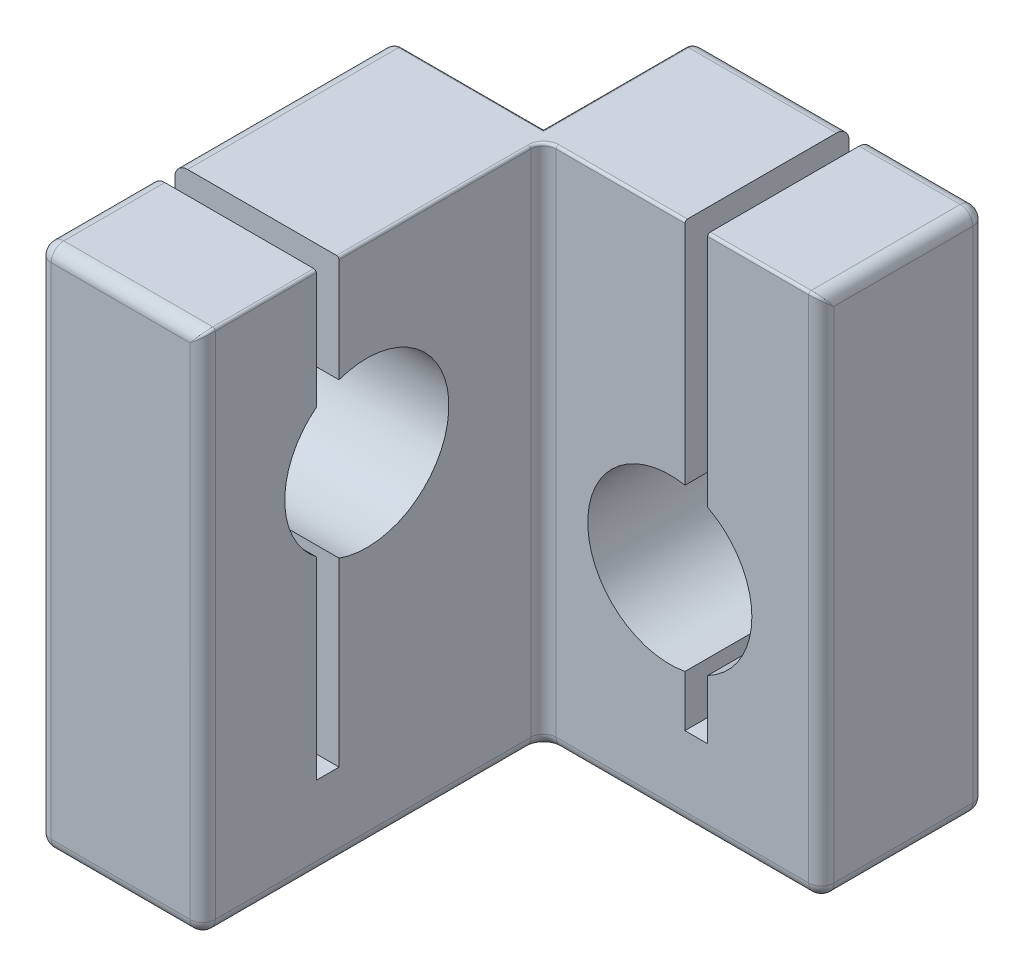
from build123d import *

# Parameters (mm, degrees)
BOSS_EXTRUDE1_DEPTH = 41.55
SKETCH2_W           = 12.292893219
SKETCH2_H           = 12.292893219
CUT_EXTRUDE1_DEPTH  = 13.25
FILLET1_R           = 4
FILLET2_R           = 1
FILLET3_R           = 0.2
SKETCH3_W           = 13
SKETCH3_H           = 1.8
SKETCH3_W_2         = 1.8
SKETCH3_H_2         = 13
CUT_EXTRUDE2_DEPTH  = 35
SKETCH4_R           = 6.5
CUT_EXTRUDE3_DEPTH  = 35
SKETCH5_R           = 6.5
CUT_EXTRUDE4_DEPTH  = 35
SKETCH6_R           = 2
CUT_EXTRUDE5_DEPTH  = 10.3


with BuildPart() as part:
    # Sketch1 → Boss-Extrude1 (new body)
    with BuildSketch(Plane(origin=(0, 0, 0), x_dir=(1, 0, 0), z_dir=(0, 1, 0))):
        Polygon((0, 0), (0, -40), (13, -40), (13, -13), (35, -13), (35, 0), align=None)
    extrude(amount=BOSS_EXTRUDE1_DEPTH)

    # Sketch2 → Cut-Extrude1 (cut)
    with BuildSketch(Plane(origin=(0, 41.55, 0), x_dir=(1, 0, 0), z_dir=(0, 1, 0))):
        with Locations((6.14644661, -6.14644661)):
            Rectangle(SKETCH2_W, SKETCH2_H)
    extrude(amount=-CUT_EXTRUDE1_DEPTH, mode=Mode.SUBTRACT)

    # Fillet1
    fillet1_edges = [part.edges().sort_by_distance(p)[0] for p in [
        (12.292893219, 28.3, 6.146446609),
    ]]
    fillet(fillet1_edges, radius=FILLET1_R)

    # Fillet2
    fillet2_edges = [part.edges().sort_by_distance(p)[0] for p in [
        (23.646446609, 41.55, 0),
        (12.292893219, 36.925, 0),
        (11.121320344, 29.471572875, 0),
        (4.146446609, 28.3, 0),
        (0, 14.15, 0),
        (0, 28.3, 6.146446609),
        (0, 34.925, 12.292893219),
        (0, 41.55, 26.146446609),
        (0, 0, 20),
        (17.5, 0, 0),
        (35, 41.55, 6.5),
        (35, 20.775, 0),
        (35, 0, 6.5),
        (13, 0, 26.5),
        (13, 20.775, 13),
        (35, 20.775, 13),
        (24, 0, 13),
        (0, 20.775, 40),
        (6.5, 41.55, 40),
        (13, 20.775, 40),
        (6.5, 0, 40),
    ]]
    fillet(fillet2_edges, radius=FILLET2_R)

    # Fillet3
    fillet3_edges = [part.edges().sort_by_distance(p)[0] for p in [
        (0.236703983, 41.196048907, 12.646844311),
        (12.646844311, 41.196048907, 0.236703983),
        (6.646446609, 41.55, 12.292893219),
        (12.292893219, 41.55, 6.646446609),
        (12.646048907, 41.196048907, 39.763296017),
        (34.763296017, 41.196048907, 12.646048907),
        (24, 41.55, 13),
        (13.292893219, 41.55, 13.292893219),
        (13, 41.55, 26.5),
    ]]
    fillet(fillet3_edges, radius=FILLET3_R)

    # Sketch3 → Cut-Extrude2 (cut)
    with BuildSketch(Plane(origin=(0, 41.55, 0), x_dir=(1, 0, 0), z_dir=(0, 1, 0))):
        with Locations((6.5, -30.1)):
            Rectangle(SKETCH3_W, SKETCH3_H)
        with Locations((25.1, -6.5)):
            Rectangle(SKETCH3_W_2, SKETCH3_H_2)
    extrude(amount=-CUT_EXTRUDE2_DEPTH, mode=Mode.SUBTRACT)

    # Sketch4 → Cut-Extrude3 (cut)
    with BuildSketch(Plane.XY.offset(13)):
        with Locations((23, 17)):
            Circle(SKETCH4_R)
    extrude(amount=-CUT_EXTRUDE3_DEPTH, mode=Mode.SUBTRACT)

    # Sketch5 → Cut-Extrude4 (cut)
    with BuildSketch(Plane(origin=(13, 0, 0), x_dir=(0, 0, -1), z_dir=(1, 0, 0))):
        with Locations((-27, 27)):
            Circle(SKETCH5_R)
    extrude(amount=-CUT_EXTRUDE4_DEPTH, mode=Mode.SUBTRACT)

    # Sketch6 → Cut-Extrude5 (cut)
    with BuildSketch(Plane.XZ):
        with Locations((5, 27.5)):
            Circle(SKETCH6_R)
        with Locations((5, 15)):
            Circle(SKETCH6_R)
        with Locations((29, 6)):
            Circle(SKETCH6_R)
    extrude(amount=-CUT_EXTRUDE5_DEPTH, mode=Mode.SUBTRACT)


solid = part.part
